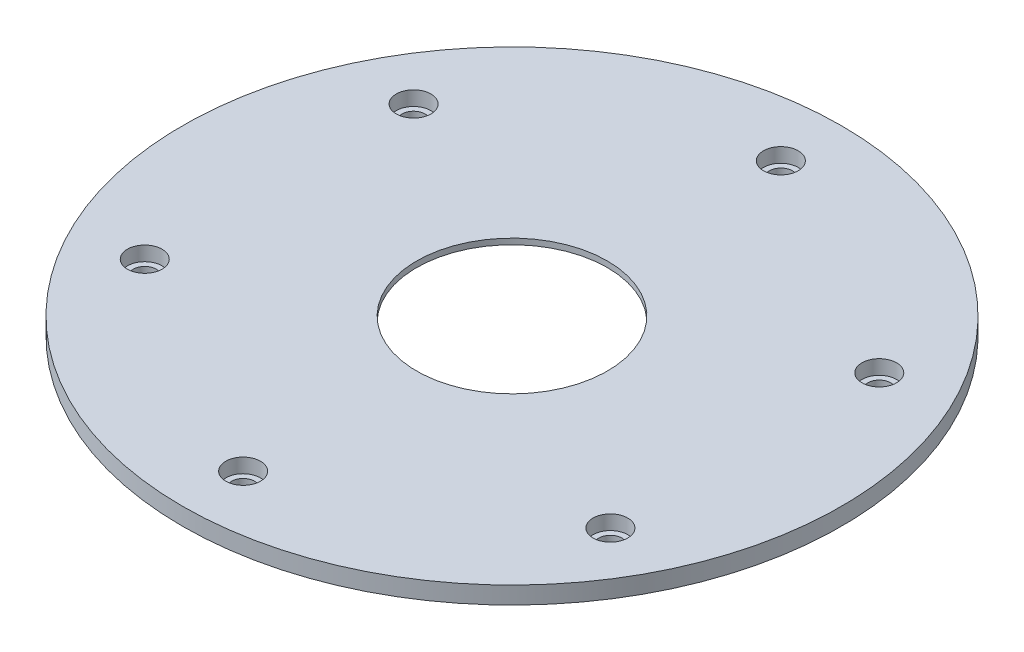
from build123d import *

# Parameters (mm, degrees)
SKETCH1_R           = 57
BOSS_EXTRUDE1_DEPTH = 3
SKETCH2_R           = 2
CUT_EXTRUDE1_DEPTH  = 81.665977958
CIRPATTERN1_COUNT   = 6
SKETCH5_R           = 3.25
BOSS_EXTRUDE2_DEPTH = 5
SKETCH4_R           = 16.5
CUT_EXTRUDE3_DEPTH  = 81.765091469
SKETCH8_R           = 2
CUT_EXTRUDE4_DEPTH  = 82.006172604
SKETCH9_R           = 3
CUT_EXTRUDE5_DEPTH  = 2.5
CUT_EXTRUDE7_DEPTH  = 2
CIRPATTERN3_COUNT   = 6
SKETCH12_R          = 25
SKETCH12_R_2        = 22.5
BOSS_EXTRUDE3_DEPTH = 2


with BuildPart() as part:
    # Sketch1 → Boss-Extrude1 (new body)
    with BuildSketch(Plane(origin=(0, 0, 0), x_dir=(1, 0, 0), z_dir=(0, 1, 0))):
        Circle(SKETCH1_R)
    extrude(amount=BOSS_EXTRUDE1_DEPTH)

    # Sketch2 → Cut-Extrude1 (cut, through all)
    with BuildSketch(Plane(origin=(0, 3, 0), x_dir=(1, 0, 0), z_dir=(0, 1, 0))):
        with Locations((0, 46.5)):
            Circle(SKETCH2_R)
    cut_extrude1 = extrude(amount=-CUT_EXTRUDE1_DEPTH, mode=Mode.SUBTRACT)

    # CirPattern1: Cut-Extrude1 ×6 about axis
    cirpattern1_axis = Axis((0, 3, 0), (0, 1, 0))
    for i in range(1, CIRPATTERN1_COUNT):
        add(cut_extrude1.rotate(cirpattern1_axis, i * 360 / CIRPATTERN1_COUNT), mode=Mode.SUBTRACT)

    # Sketch5 → Boss-Extrude2 (add)
    with BuildSketch(Plane.XZ):
        with Locations((0, 46.5)):
            Circle(SKETCH5_R)
        with Locations((40.270181276, 23.25)):
            Circle(SKETCH5_R)
        with Locations((40.270181276, -23.25)):
            Circle(SKETCH5_R)
        with Locations((0, -46.5)):
            Circle(SKETCH5_R)
        with Locations((-40.270181276, -23.25)):
            Circle(SKETCH5_R)
        with Locations((-40.270181276, 23.25)):
            Circle(SKETCH5_R)
    extrude(amount=BOSS_EXTRUDE2_DEPTH)

    # Sketch4 → Cut-Extrude3 (cut, through all)
    with BuildSketch(Plane.XZ):
        Circle(SKETCH4_R)
    extrude(amount=-CUT_EXTRUDE3_DEPTH, mode=Mode.SUBTRACT)

    # Sketch8 → Cut-Extrude4 (cut, through all)
    with BuildSketch(Plane(origin=(0, 3, 0), x_dir=(1, 0, 0), z_dir=(0, 1, 0))):
        with Locations((-40.270181276, -23.25)):
            Circle(SKETCH8_R)
        with Locations((0, -46.5)):
            Circle(SKETCH8_R)
        with Locations((40.270181276, -23.25)):
            Circle(SKETCH8_R)
        with Locations((40.270181276, 23.25)):
            Circle(SKETCH8_R)
        with Locations((0, 46.5)):
            Circle(SKETCH8_R)
        with Locations((-40.270181276, 23.25)):
            Circle(SKETCH8_R)
    extrude(amount=-CUT_EXTRUDE4_DEPTH, mode=Mode.SUBTRACT)

    # Sketch9 → Cut-Extrude5 (cut)
    with BuildSketch(Plane(origin=(0, 3, 0), x_dir=(1, 0, 0), z_dir=(0, 1, 0))):
        with Locations((-40.270181276, 23.25)):
            Circle(SKETCH9_R)
        with Locations((0, 46.5)):
            Circle(SKETCH9_R)
        with Locations((40.270181276, 23.25)):
            Circle(SKETCH9_R)
        with Locations((40.270181276, -23.25)):
            Circle(SKETCH9_R)
        with Locations((0, -46.5)):
            Circle(SKETCH9_R)
        with Locations((-40.270181276, -23.25)):
            Circle(SKETCH9_R)
    extrude(amount=-CUT_EXTRUDE5_DEPTH, mode=Mode.SUBTRACT)

    # Sketch11 → Cut-Extrude7 (cut)
    with BuildSketch(Plane.XZ):
        with BuildLine():
            ThreePointArc((-50.023085711, 17.512592496), (-53, 0), (-50.023085711, -17.512592496))
            ThreePointArc((-50.023085711, -17.512592496), (-47.298125213, -20.050515589), (-43.662860234, -19.243476633))
            ThreePointArc((-43.662860234, -19.243476633), (-35.723547906, -20.625), (-38.496769739, -28.191407848))
            ThreePointArc((-38.496769739, -28.191407848), (-41.013318465, -30.936120192), (-40.177892843, -34.564966754))
            ThreePointArc((-40.177892843, -34.564966754), (-26.5, -45.899346401), (-9.845192868, -52.07755925))
            ThreePointArc((-9.845192868, -52.07755925), (-6.284806748, -50.98663578), (-5.166090495, -47.434884481))
            ThreePointArc((-5.166090495, -47.434884481), (0, -41.25), (5.166090495, -47.434884481))
            ThreePointArc((5.166090495, -47.434884481), (6.284806748, -50.98663578), (9.845192868, -52.07755925))
            ThreePointArc((9.845192868, -52.07755925), (26.5, -45.899346401), (40.177892843, -34.564966754))
            ThreePointArc((40.177892843, -34.564966754), (41.013318465, -30.936120192), (38.496769739, -28.191407848))
            ThreePointArc((38.496769739, -28.191407848), (35.723547906, -20.625), (43.662860234, -19.243476633))
            ThreePointArc((43.662860234, -19.243476633), (47.298125213, -20.050515589), (50.023085711, -17.512592496))
            ThreePointArc((50.023085711, -17.512592496), (53, 0), (50.023085711, 17.512592496))
            ThreePointArc((50.023085711, 17.512592496), (47.298125213, 20.050515589), (43.662860234, 19.243476633))
            ThreePointArc((43.662860234, 19.243476633), (35.723547906, 20.625), (38.496769739, 28.191407848))
            ThreePointArc((38.496769739, 28.191407848), (41.013318465, 30.936120192), (40.177892843, 34.564966754))
            ThreePointArc((40.177892843, 34.564966754), (26.5, 45.899346401), (9.845192868, 52.07755925))
            ThreePointArc((9.845192868, 52.07755925), (6.284806748, 50.98663578), (5.166090495, 47.434884481))
            ThreePointArc((5.166090495, 47.434884481), (0, 41.25), (-5.166090495, 47.434884481))
            ThreePointArc((-5.166090495, 47.434884481), (-6.284806748, 50.98663578), (-9.845192868, 52.07755925))
            ThreePointArc((-9.845192868, 52.07755925), (-26.5, 45.899346401), (-40.177892843, 34.564966754))
            ThreePointArc((-40.177892843, 34.564966754), (-41.013318465, 30.936120192), (-38.496769739, 28.191407848))
            ThreePointArc((-38.496769739, 28.191407848), (-35.723547906, 20.625), (-43.662860234, 19.243476633))
            ThreePointArc((-43.662860234, 19.243476633), (-47.298125213, 20.050515589), (-50.023085711, 17.512592496))
        make_face()
    cut_extrude7 = extrude(amount=-CUT_EXTRUDE7_DEPTH, mode=Mode.SUBTRACT)

    # CirPattern3: Cut-Extrude7 ×6 about axis
    cirpattern3_axis = Axis((0, 0, 0), (0, -1, 0))
    for i in range(1, CIRPATTERN3_COUNT):
        add(cut_extrude7.rotate(cirpattern3_axis, i * 360 / CIRPATTERN3_COUNT), mode=Mode.SUBTRACT)

    # Sketch12 → Boss-Extrude3 (add)
    with BuildSketch(Plane.XZ.offset(-2)):
        Circle(SKETCH12_R)
        Circle(SKETCH12_R_2, mode=Mode.SUBTRACT)
    extrude(amount=BOSS_EXTRUDE3_DEPTH)


solid = part.part
